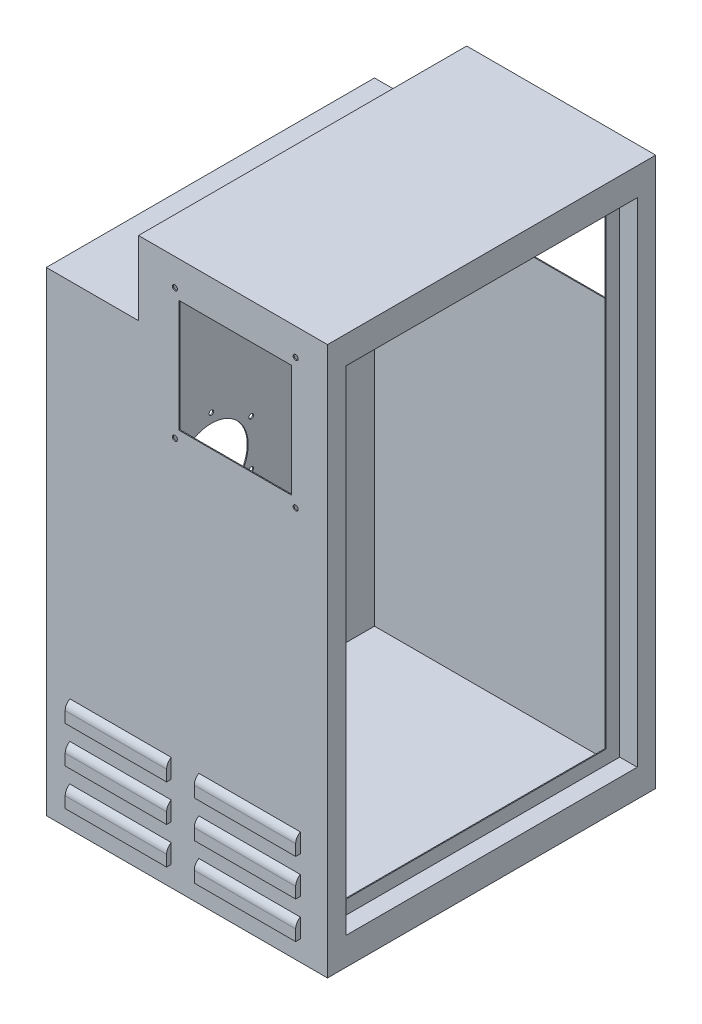
from build123d import *

# Parameters (mm, degrees)
EXTRUDE_1_DEPTH                = 1
SKETCH_2_R                     = 2.75
SKETCH_2_W                     = 122
SKETCH_2_H                     = 122
CUT_EXTRUDE_2_DEPTH            = 5.5
SKETCH_7_W                     = 110
SKETCH_7_H                     = 20.62
EXTRUDE_4_DEPTH                = 5
FILLET_2_R                     = 10
PATTERN_LINEAR_3_COUNT         = 2
PATTERN_LINEAR_3_PITCH         = 140
FILLET_2_OF_PATTERN_LINEAR_3_R = 10
PATTERN_START                  = 25.494191811
PATTERN_LINEAR_4_DEPTH         = 110
PATTERN_START_2                = 165.494191811
PATTERN_LINEAR_4_2_DEPTH       = 110
EXTRUDE_4_2_DEPTH              = 355
SKETCH_19_R                    = 40
SKETCH_19_R_2                  = 2.5
CUT_EXTRUDE_3_DEPTH            = 355
PATTERN_CIRCULAR_1_COUNT       = 6
SKETCH_20_R                    = 30
CUT_EXTRUDE_4_DEPTH            = 355
PATTERN_CIRCULAR_2_COUNT       = 7
WRAP_3_DEPTH                   = 1
SKETCH_57_R                    = 1.6
SKETCH_57_R_2                  = 10.25
SKETCH_57_R_3                  = 1.75
SKETCH_57_R_4                  = 16.25
SKETCH_57_R_5                  = 2.25
SKETCH_57_R_6                  = 27.75
CUT_EXTRUDE_5_DEPTH            = 355
SKETCH_58_W                    = 356
SKETCH_58_H                    = 595
SKETCH_58_W_2                  = 316
SKETCH_58_H_2                  = 535
EXTRUDE_5_DEPTH                = 19
SKETCH_60_W                    = 318
SKETCH_60_H                    = 537
SKETCH_60_W_2                  = 316
SKETCH_60_H_2                  = 535
EXTRUDE_6_DEPTH                = 19
SKETCH_62_W                    = 318
SKETCH_62_H                    = 537
SKETCH_62_W_2                  = 286
SKETCH_62_H_2                  = 505
EXTRUDE_7_DEPTH                = 1


# Read off the part's stored shape, not the designer's step: 阵列(线性)4, 包覆3
with BuildPart() as part:
    # Sketch 1 → 凸台-拉伸1 (new body)
    with BuildSketch(Plane.XY):
        Polygon((0, 0), (0, 515), (100, 515), (100, 595), (305, 595), (305, 0), align=None)
    extrude(amount=-EXTRUDE_1_DEPTH)

    # Sketch 2 → 切除-拉伸2 (cut)
    with BuildSketch(Plane.XY):
        with Locations((139.5, 565.657827013)):
            Circle(SKETCH_2_R)
        with Locations((270.5, 565.657827013)):
            Circle(SKETCH_2_R)
        with Locations(Location((270.5, 424.342172987, 0), (0, 0, 180))):
            Circle(SKETCH_2_R)
        with Locations(Location((139.5, 424.342172987, 0), (0, 0, 180))):
            Circle(SKETCH_2_R)
        with Locations((205, 495)):
            Rectangle(SKETCH_2_W, SKETCH_2_H)
    extrude(amount=-CUT_EXTRUDE_2_DEPTH, mode=Mode.SUBTRACT)

    # 草图7 → Extrude 4 (add)
    with BuildSketch(Plane(origin=(0, 0, -1), x_dir=(-1, 0, 0), z_dir=(0, 0, -1))):
        with Locations((-220.494191811, 112.213490862)):
            Rectangle(SKETCH_7_W, SKETCH_7_H)
    extrude_4 = extrude(amount=EXTRUDE_4_DEPTH)

    # 圆角2
    # the kernel refuses this fillet: 10 mm, written as the material it takes off along each edge
    with BuildSketch(Plane(origin=(297.144826906, 122.523490862, -6), x_dir=(0, 0, 1), z_dir=(-1, 0, 0))) as fillet_2_piece_1:
        with BuildLine():
            CenterArc((10, -8.660254038), FILLET_2_R, 120, 60)
            Line((0, -8.660254038), (-0.2, -8.660254038))
            Line((-0.2, -8.660254038), (-0.2, 0))
            Line((-0.2, 0), (0, 0.2))
            ThreePointArc((0, 0.2), (2.5, 0.2), (4.9, 0.173205081))
            Line((4.9, 0.173205081), (5, 0))
        make_face()
    extrude(amount=153.301270189, mode=Mode.SUBTRACT)

    # 阵列(线性)3: Extrude 4 ×2
    with Locations(*[(-i * PATTERN_LINEAR_3_PITCH, 0, 0) for i in range(1, PATTERN_LINEAR_3_COUNT)]):
        add(extrude_4)

    # 圆角2 of 阵列(线性)3
    # the kernel refuses this fillet: 10 mm, written as the material it takes off along each edge
    with BuildSketch(Plane(origin=(157.144826906, 122.523490862, -6), x_dir=(0, 0, 1), z_dir=(-1, 0, 0))) as fillet_2_of_pattern_linear_3_piece_1:
        with BuildLine():
            CenterArc((10, -8.660254038), FILLET_2_OF_PATTERN_LINEAR_3_R, 120, 60)
            Line((0, -8.660254038), (-0.2, -8.660254038))
            Line((-0.2, -8.660254038), (-0.2, 0))
            Line((-0.2, 0), (0, 0.2))
            ThreePointArc((0, 0.2), (2.5, 0.2), (4.9, 0.173205081))
            Line((4.9, 0.173205081), (5, 0))
        make_face()
    extrude(amount=153.301270189, mode=Mode.SUBTRACT)

    # 阵列(线性)4 outline → 阵列(线性)4 (add)
    with BuildSketch(Plane.YZ.offset(PATTERN_START)):
        with BuildLine():
            Line((21.903490862, -6), (33.863236824, -6))
            ThreePointArc((33.863236824, -6), (38.863236824, -4.660254038), (42.523490862, -1))
            Line((42.523490862, -1), (21.903490862, -1))
            Line((21.903490862, -1), (21.903490862, -6))
        make_face()
        with BuildLine():
            Line((82.523490862, -1), (61.903490862, -1))
            Line((61.903490862, -1), (61.903490862, -6))
            Line((61.903490862, -6), (73.863236824, -6))
            ThreePointArc((73.863236824, -6), (78.863236824, -4.660254038), (82.523490862, -1))
        make_face()
    extrude(amount=PATTERN_LINEAR_4_DEPTH)

    # Pattern Linear 4 2 outline → Pattern Linear 4 2 (add)
    with BuildSketch(Plane.YZ.offset(PATTERN_START_2)):
        with BuildLine():
            Line((21.903490862, -6), (33.863236824, -6))
            ThreePointArc((33.863236824, -6), (38.863236824, -4.660254038), (42.523490862, -1))
            Line((42.523490862, -1), (21.903490862, -1))
            Line((21.903490862, -1), (21.903490862, -6))
        make_face()
        with BuildLine():
            Line((82.523490862, -1), (61.903490862, -1))
            Line((61.903490862, -1), (61.903490862, -6))
            Line((61.903490862, -6), (73.863236824, -6))
            ThreePointArc((73.863236824, -6), (78.863236824, -4.660254038), (82.523490862, -1))
        make_face()
    extrude(amount=PATTERN_LINEAR_4_2_DEPTH)

    # 草图13 → Extrude 4 2 (add)
    with BuildSketch(Plane.XY):
        Polygon((305, 595), (100, 595), (100, 515), (0, 515), (0, 0), (305, 0), (305, 1), (1, 1), (1, 514), (101, 514), (101, 594), (305, 594), align=None)
    extrude(amount=EXTRUDE_4_2_DEPTH)

    # 镜向2: part across plane


with BuildPart() as part_1:
    add(part.part)
    add(part.part.mirror(Plane(origin=(0, 0, 177), x_dir=(1, 0, 0), z_dir=(0, 0, -1))))

    # 草图19 → 切除-拉伸3 (cut)
    with BuildSketch(Plane.ZY):
        with Locations((177, 240)):
            Circle(SKETCH_19_R)
        with Locations((177, 290)):
            Circle(SKETCH_19_R_2)
    cut_extrude_3 = extrude(amount=-CUT_EXTRUDE_3_DEPTH, mode=Mode.SUBTRACT)

    # 阵列(圆周)1: 切除-拉伸3 ×6 about axis
    pattern_circular_1_axis = Axis((0, 240, 177), (1, 0, 0))
    for i in range(1, PATTERN_CIRCULAR_1_COUNT):
        add(cut_extrude_3.rotate(pattern_circular_1_axis, i * 360 / PATTERN_CIRCULAR_1_COUNT), mode=Mode.SUBTRACT)

    # 草图20 → 切除-拉伸4 (cut)
    with BuildSketch(Plane.ZY):
        with Locations((177, 57.5)):
            Circle(SKETCH_20_R)
        with BuildLine():
            Line((181, 102.5), (181, 97.5))
            ThreePointArc((181, 97.5), (177, 93.5), (173, 97.5))
            Line((173, 97.5), (173, 102.5))
            ThreePointArc((173, 102.5), (177, 106.5), (181, 102.5))
        make_face()
    cut_extrude_4 = extrude(amount=-CUT_EXTRUDE_4_DEPTH, mode=Mode.SUBTRACT)

    # 阵列(圆周)2: 切除-拉伸4 ×7 about axis
    pattern_circular_2_axis = Axis((0, 57.5, 177), (1, 0, 0))
    for i in range(1, PATTERN_CIRCULAR_2_COUNT):
        add(cut_extrude_4.rotate(pattern_circular_2_axis, i * 360 / PATTERN_CIRCULAR_2_COUNT), mode=Mode.SUBTRACT)

    # 包覆3 outline → 包覆3 (add)
    with BuildSketch(Plane.ZY):
        Polygon((7.082692308, 2.849358974), (7.082692308, 0), (7.367628205, 0), (7.367628205, 2.849358974), (8.059615385, 2.849358974), (8.059615385, 3.175), (6.390705128, 3.175), (6.390705128, 2.849358974), align=None)
        Polygon((0.732692308, 0), (1.017628205, 0), (1.017628205, 2.849358974), (1.709615385, 2.849358974), (1.709615385, 3.175), (0.040705128, 3.175), (0.040705128, 2.849358974), (0.732692308, 2.849358974), align=None)
        Polygon((2.198076923, 0), (3.989102564, 0), (3.989102564, 0.325641026), (2.483012821, 0.325641026), (2.483012821, 1.546794872), (3.989102564, 1.546794872), (3.989102564, 1.872435897), (2.483012821, 1.872435897), (2.483012821, 2.849358974), (3.989102564, 2.849358974), (3.989102564, 3.175), (2.198076923, 3.175), align=None)
        with BuildLine():
            add(Edge.make_bspline(
                [(4.931044671, 2.11857472), (4.937994631, 2.11237256), (4.954506143, 2.09763765), (4.984692161, 2.073514653), (5.024554557, 2.043757852), (5.073052411, 2.006939358), (5.131079946, 1.964229746), (5.198643544, 1.916175112), (5.274990077, 1.861215445), (5.329166386, 1.822791105), (5.3578125, 1.802473958)],
                knots=[0, 0, 0, 0, 0.052594282, 0.124951974, 0.218093899, 0.333502411, 0.468789179, 0.624937586, 0.801683048, 1, 1, 1, 1], degree=3))
            add(Edge.make_bspline(
                [(4.721794872, 2.52880609), (4.722151494, 2.51179582), (4.722865321, 2.477747465), (4.73282103, 2.427445104), (4.745611136, 2.377269817), (4.765879095, 2.327447189), (4.793860192, 2.277105877), (4.830604173, 2.225379015), (4.876880534, 2.17181068), (4.912328967, 2.136969705), (4.931044671, 2.11857472)],
                knots=[0, 0, 0, 0, 0.107285214, 0.214745861, 0.32293856, 0.434116163, 0.553412311, 0.686072985, 0.834255992, 1, 1, 1, 1], degree=3))
            add(Edge.make_bspline(
                [(5.187359776, 2.930769231), (5.154560645, 2.929670046), (5.09131061, 2.927550371), (5.001512325, 2.904400099), (4.920691407, 2.867949411), (4.851247294, 2.816863681), (4.793428751, 2.756338209), (4.751604513, 2.686688819), (4.72643115, 2.609779068), (4.72335931, 2.556129137), (4.721794872, 2.52880609)],
                knots=[0, 0, 0, 0, 0.143073084, 0.275902964, 0.402370856, 0.528413645, 0.650356379, 0.765895086, 0.880774131, 1, 1, 1, 1], degree=3))
            add(Edge.make_bspline(
                [(5.807476963, 2.523717949), (5.791923153, 2.543755546), (5.761970151, 2.582343275), (5.716495545, 2.636382968), (5.673634272, 2.685746489), (5.631406409, 2.728622712), (5.592042186, 2.767359647), (5.553836012, 2.80052457), (5.517337708, 2.828442431), (5.471330225, 2.858236232), (5.413529152, 2.887769632), (5.340971751, 2.912760581), (5.265147059, 2.927778387), (5.21350375, 2.929764021), (5.187359776, 2.930769231)],
                knots=[0, 0, 0, 0, 0.098469431, 0.189629101, 0.274184089, 0.352183161, 0.423198873, 0.488550946, 0.548473346, 0.601440164, 0.701198082, 0.799591802, 0.898545098, 1, 1, 1, 1], degree=3))
            Line((5.807476963, 2.523717949), (6.065064103, 2.718975361))
            add(Edge.make_bspline(
                [(5.219160657, 3.256410256), (5.256574948, 3.255119799), (5.330980031, 3.252553491), (5.440426106, 3.230240016), (5.54580047, 3.193318692), (5.63056686, 3.151418981), (5.696908722, 3.109571197), (5.747502558, 3.071453213), (5.79877196, 3.027570079), (5.851130481, 2.977804906), (5.903690936, 2.921701067), (5.95723364, 2.8596428), (6.011883798, 2.792009352), (6.047040899, 2.743727127), (6.065064103, 2.718975361)],
                knots=[0, 0, 0, 0, 0.107232799, 0.213251813, 0.318830447, 0.426793531, 0.483645951, 0.543603822, 0.60830765, 0.67712676, 0.750685636, 0.828713418, 0.912190348, 1, 1, 1, 1], degree=3))
            add(Edge.make_bspline(
                [(4.436858974, 2.51544972), (4.438042985, 2.549041015), (4.4403857, 2.615505616), (4.460198169, 2.712597869), (4.491470008, 2.805295548), (4.535280371, 2.892680922), (4.591756684, 2.972478633), (4.657112675, 3.045606582), (4.734955952, 3.107082367), (4.820365832, 3.160796163), (4.913852683, 3.202838538), (5.01181586, 3.234553141), (5.114411061, 3.252522968), (5.183901047, 3.255101762), (5.219160657, 3.256410256)],
                knots=[0, 0, 0, 0, 0.083785371, 0.165779888, 0.246280008, 0.327460928, 0.408796954, 0.489715241, 0.571376032, 0.655523321, 0.741019483, 0.826546761, 0.911988852, 1, 1, 1, 1], degree=3))
            add(Edge.make_bspline(
                [(4.614307893, 2.032076322), (4.600272084, 2.050764406), (4.572668782, 2.08751703), (4.536232477, 2.144961722), (4.505263379, 2.203765684), (4.480986121, 2.264086933), (4.460542551, 2.325078618), (4.446792142, 2.387536534), (4.438182089, 2.451180424), (4.437300359, 2.494009814), (4.436858974, 2.51544972)],
                knots=[0, 0, 0, 0, 0.133506769, 0.262558979, 0.388264447, 0.512667355, 0.63372227, 0.75539386, 0.877552945, 1, 1, 1, 1], degree=3))
            add(Edge.make_bspline(
                [(5.134570313, 1.600220353), (5.101165687, 1.624013428), (5.037298588, 1.669503978), (4.947982588, 1.737017435), (4.868113682, 1.798742946), (4.79804686, 1.855261585), (4.73781294, 1.90658102), (4.686937275, 1.952208436), (4.646715869, 1.993377809), (4.624349735, 2.020085312), (4.614307893, 2.032076322)],
                knots=[0, 0, 0, 0, 0.181535301, 0.347081672, 0.495567816, 0.628357302, 0.74551967, 0.845830751, 0.930781807, 1, 1, 1, 1], degree=3))
            add(Edge.make_bspline(
                [(5.706986178, 1.093950321), (5.692770692, 1.112135653), (5.662927058, 1.150313485), (5.611621314, 1.207141663), (5.551417768, 1.2657598), (5.484376686, 1.32840623), (5.408055955, 1.392167303), (5.324845996, 1.460083527), (5.232622352, 1.5295721), (5.167943523, 1.576174356), (5.134570313, 1.600220353)],
                knots=[0, 0, 0, 0, 0.090279215, 0.189529918, 0.299197872, 0.418925887, 0.548376285, 0.68813637, 0.839083502, 1, 1, 1, 1], degree=3))
            add(Edge.make_bspline(
                [(5.820833333, 0.782301683), (5.819495923, 0.808736596), (5.816777163, 0.862474913), (5.793797892, 0.941758884), (5.757648932, 1.020220001), (5.724299962, 1.068753292), (5.706986178, 1.093950321)],
                knots=[0, 0, 0, 0, 0.234723374, 0.477158319, 0.728556284, 1, 1, 1, 1], degree=3))
            add(Edge.make_bspline(
                [(5.198808093, 0.244230769), (5.226645459, 0.245006079), (5.281833103, 0.246543133), (5.363078852, 0.261312147), (5.441983773, 0.284001721), (5.516921609, 0.316496423), (5.586858345, 0.355810621), (5.648187275, 0.403296082), (5.70120625, 0.456460283), (5.744575946, 0.515771691), (5.777849978, 0.57955939), (5.803424212, 0.645033288), (5.817616529, 0.713221918), (5.819754441, 0.759132838), (5.820833333, 0.782301683)],
                knots=[0, 0, 0, 0, 0.091263605, 0.180930311, 0.27008822, 0.360156133, 0.448342532, 0.532665842, 0.613833704, 0.693981527, 0.772715977, 0.849335172, 0.923967327, 1, 1, 1, 1], degree=3))
            add(Edge.make_bspline(
                [(4.501732772, 0.773397436), (4.526695745, 0.731610458), (4.574523837, 0.651548221), (4.654308284, 0.543364142), (4.736978853, 0.451414185), (4.823147749, 0.376233263), (4.912289002, 0.317043201), (5.004984536, 0.275131177), (5.100921979, 0.24899097), (5.166212517, 0.245815892), (5.198808093, 0.244230769)],
                knots=[0, 0, 0, 0, 0.159004299, 0.3046461, 0.438546905, 0.562322299, 0.677432543, 0.786897393, 0.893610889, 1, 1, 1, 1], degree=3))
            Line((4.501732772, 0.773397436), (4.233333333, 0.612484976))
            add(Edge.make_bspline(
                [(4.810203862, 6e-09), (4.80423564, 0.002688656), (4.777216664, 0.015230497), (4.729894923, 0.040257623), (4.66928183, 0.07771811), (4.610159543, 0.12131335), (4.553082597, 0.172089307), (4.496178264, 0.228645587), (4.441126126, 0.292518026), (4.386812631, 0.362674716), (4.334308645, 0.439772046), (4.282527373, 0.523390074), (4.250037627, 0.582231974), (4.233333333, 0.612484976)],
                knots=[0.318177202, 0.318177202, 0.318177202, 0.318177202, 0.333794217, 0.389241459, 0.445822073, 0.503704281, 0.564293892, 0.627975416, 0.69503826, 0.765372726, 0.839611443, 0.91753775, 1, 1, 1, 1], degree=3))
            Line((4.810203862, 6e-09), (5.588919181, -3e-09))
            add(Edge.make_bspline(
                [(6.105769231, 0.777849559), (6.105173113, 0.7493849), (6.103992453, 0.693008344), (6.090420766, 0.610226953), (6.070536499, 0.529826093), (6.040567008, 0.452799584), (6.003988143, 0.377738263), (5.957573047, 0.306611097), (5.903772504, 0.237843864), (5.84205616, 0.173270268), (5.774523092, 0.113991933), (5.70314574, 0.06126057), (5.640440015, 0.02466537), (5.601710054, 0.005836497), (5.588919181, -3e-09)],
                knots=[0, 0, 0, 0, 0.061484255, 0.121774528, 0.18091956, 0.240256115, 0.300114444, 0.361145948, 0.423500582, 0.488669361, 0.553954105, 0.617581261, 0.680238427, 0.710624473, 0.710624473, 0.710624473, 0.710624473], degree=3))
            add(Edge.make_bspline(
                [(5.3578125, 1.802473958), (5.39227115, 1.777399296), (5.45899555, 1.728845689), (5.553934926, 1.655897179), (5.640017166, 1.584552418), (5.717544501, 1.515267017), (5.787282839, 1.448566533), (5.848458486, 1.383648505), (5.901694781, 1.320978021), (5.959007358, 1.240630042), (6.017570523, 1.141950058), (6.06786389, 1.021047656), (6.099576106, 0.899675279), (6.103723123, 0.818098792), (6.105769231, 0.777849559)],
                knots=[0, 0, 0, 0, 0.09697231, 0.187773439, 0.272396139, 0.351320997, 0.424334774, 0.491908784, 0.55423322, 0.611267658, 0.716347845, 0.814540086, 0.908495456, 1, 1, 1, 1], degree=3))
        make_face()
        with BuildLine():
            add(Edge.make_bspline(
                [(182.432692308, 438.743589744), (182.747186448, 438.21713963), (183.349745083, 437.208481528), (184.354903474, 435.845532495), (185.396422459, 434.687107846), (186.482014842, 433.739946617), (187.605054249, 432.994245054), (188.772872006, 432.466219549), (189.9815327, 432.136894116), (190.80409066, 432.096893127), (191.21474359, 432.076923077)],
                knots=[0, 0, 0, 0, 0.159004299, 0.3046461, 0.438546905, 0.562322299, 0.677432543, 0.786897393, 0.893610889, 1, 1, 1, 1], degree=3))
            Line((182.432692308, 438.743589744), (179.051282051, 436.716346154))
            add(Edge.make_bspline(
                [(191.21474359, 427.974358974), (190.912625384, 427.98020105), (190.312193841, 427.991811626), (189.424085477, 428.09445483), (188.553918743, 428.239678872), (187.712612662, 428.470239671), (186.889327958, 428.749976552), (186.087645278, 429.094414639), (185.307176091, 429.507182655), (184.543546572, 429.979125794), (183.798698863, 430.52835716), (183.079619229, 431.168054262), (182.362714252, 431.880574319), (181.669144008, 432.685266472), (180.984879502, 433.569130276), (180.323411964, 434.540435229), (179.671049477, 435.593890701), (179.261729844, 436.335205966), (179.051282051, 436.716346154)],
                knots=[0, 0, 0, 0, 0.057208269, 0.11369606, 0.169177916, 0.224159217, 0.278719878, 0.333794217, 0.389241459, 0.445822073, 0.503704281, 0.564293892, 0.627975416, 0.69503826, 0.765372726, 0.839611443, 0.91753775, 1, 1, 1, 1], degree=3))
            add(Edge.make_bspline(
                [(202.641025641, 438.799679487), (202.633515491, 438.4410696), (202.618641033, 437.730813788), (202.447659161, 436.687898624), (202.197148702, 435.674974399), (201.819580314, 434.704561685), (201.35874422, 433.758907255), (200.773987101, 432.862816964), (200.09618499, 431.996458123), (199.318656248, 431.182932508), (198.467845936, 430.43611884), (197.568603712, 429.771786708), (196.619457735, 429.217863012), (195.625556973, 428.765853389), (194.586673125, 428.412327474), (193.503155595, 428.156180399), (192.373218324, 427.998972274), (191.605212821, 427.982655), (191.21474359, 427.974358974)],
                knots=[0, 0, 0, 0, 0.061484255, 0.121774528, 0.18091956, 0.240256115, 0.300114444, 0.361145948, 0.423500582, 0.488669361, 0.553954105, 0.617581261, 0.680238427, 0.742187389, 0.804663212, 0.868258989, 0.933020257, 1, 1, 1, 1], degree=3))
            add(Edge.make_bspline(
                [(193.217948718, 451.708333333), (193.652073441, 451.392432081), (194.4926958, 450.78073309), (195.688782428, 449.861696747), (196.773283092, 448.962865106), (197.750005418, 448.089978168), (198.628598657, 447.249657105), (199.399315465, 446.431792187), (200.070008955, 445.642242785), (200.792057166, 444.629984777), (201.529860817, 443.386772385), (202.163478045, 441.863592516), (202.563002016, 440.33449171), (202.615247907, 439.306756436), (202.641025641, 438.799679487)],
                knots=[0, 0, 0, 0, 0.09697231, 0.187773439, 0.272396139, 0.351320997, 0.424334774, 0.491908784, 0.55423322, 0.611267658, 0.716347845, 0.814540086, 0.908495456, 1, 1, 1, 1], degree=3))
            add(Edge.make_bspline(
                [(187.841346154, 455.690705128), (187.928904696, 455.61256769), (188.136923749, 455.426931024), (188.517220043, 455.123019245), (189.019423451, 454.748130419), (189.630420036, 454.284275373), (190.361475599, 453.74620152), (191.212670526, 453.14078881), (192.174516616, 452.448383564), (192.857052797, 451.964297386), (193.217948718, 451.708333333)],
                knots=[0, 0, 0, 0, 0.052594282, 0.124951974, 0.218093899, 0.333502411, 0.468789179, 0.624937586, 0.801683048, 1, 1, 1, 1], degree=3))
            add(Edge.make_bspline(
                [(185.205128205, 460.858974359), (185.209621081, 460.644671747), (185.218614179, 460.215716096), (185.344040439, 459.58198556), (185.505175627, 458.949855966), (185.76051999, 458.322169305), (186.113037745, 457.687948059), (186.575954041, 457.036271058), (187.158963322, 456.361394388), (187.605557749, 455.922452973), (187.841346154, 455.690705128)],
                knots=[0, 0, 0, 0, 0.107285214, 0.214745861, 0.32293856, 0.434116163, 0.553412311, 0.686072985, 0.834255992, 1, 1, 1, 1], degree=3))
            add(Edge.make_bspline(
                [(191.070512821, 465.923076923), (190.657295422, 465.909228924), (189.860444594, 465.882524361), (188.72912761, 465.590867386), (187.710911323, 465.131646126), (186.836024866, 464.488046376), (186.107602271, 463.725520745), (185.580682742, 462.848048116), (185.263538004, 461.879106372), (185.224837666, 461.203201728), (185.205128205, 460.858974359)],
                knots=[0, 0, 0, 0, 0.143073084, 0.275902964, 0.402370856, 0.528413645, 0.650356379, 0.765895086, 0.880774131, 1, 1, 1, 1], degree=3))
            add(Edge.make_bspline(
                [(198.883012821, 460.794871795), (198.687059307, 461.047313971), (198.309698654, 461.533458579), (197.736790233, 462.214273615), (197.196805685, 462.836176238), (196.664801116, 463.37634913), (196.1688739, 463.864373511), (195.687536274, 464.282199303), (195.227715117, 464.633920394), (194.648093281, 465.009275365), (193.919890786, 465.381349691), (193.0057818, 465.696196298), (192.050510086, 465.885397005), (191.399885726, 465.910412863), (191.070512821, 465.923076923)],
                knots=[0, 0, 0, 0, 0.098469431, 0.189629101, 0.274184089, 0.352183161, 0.423198873, 0.488550946, 0.548473346, 0.601440164, 0.701198082, 0.799591802, 0.898545098, 1, 1, 1, 1], degree=3))
            Line((198.883012821, 460.794871795), (202.128205128, 463.254807692))
            add(Edge.make_bspline(
                [(191.471153846, 470.025641026), (191.942514992, 470.009383293), (192.87990187, 469.977051852), (194.258750047, 469.695937208), (195.586301092, 469.230786674), (196.654224119, 468.702916297), (197.490027107, 468.175700117), (198.127429766, 467.695473554), (198.773343489, 467.14261517), (199.432978402, 466.515652358), (200.095157367, 465.808832345), (200.769711107, 465.0269959), (201.458217036, 464.174920976), (201.901141152, 463.566640968), (202.128205128, 463.254807692)],
                knots=[0, 0, 0, 0, 0.107232799, 0.213251813, 0.318830447, 0.426793531, 0.483645951, 0.543603822, 0.60830765, 0.67712676, 0.750685636, 0.828713418, 0.912190348, 1, 1, 1, 1], degree=3))
            add(Edge.make_bspline(
                [(181.615384615, 460.690705128), (181.63030129, 461.113902552), (181.659815805, 461.951251852), (181.909421716, 463.174461342), (182.303397644, 464.342306111), (182.855339219, 465.44322421), (183.566851824, 466.448549706), (184.390234388, 467.3698467), (185.370937088, 468.144344783), (186.446967068, 468.821054022), (187.624754178, 469.350721738), (188.858935931, 469.750275797), (190.151473897, 469.976667314), (191.026938293, 470.009156055), (191.471153846, 470.025641026)],
                knots=[0, 0, 0, 0, 0.083785371, 0.165779888, 0.246280008, 0.327460928, 0.408796954, 0.489715241, 0.571376032, 0.655523321, 0.741019483, 0.826546761, 0.911988852, 1, 1, 1, 1], degree=3))
            add(Edge.make_bspline(
                [(183.850961538, 454.600961538), (183.67413245, 454.83640196), (183.326374316, 455.299427146), (182.867334254, 456.023139806), (182.477172393, 456.763977125), (182.171317169, 457.523929863), (181.913760382, 458.29232905), (181.740526888, 459.079200429), (181.632053781, 459.881013212), (181.620945363, 460.420596076), (181.615384615, 460.690705128)],
                knots=[0, 0, 0, 0, 0.133506769, 0.262558979, 0.388264447, 0.512667355, 0.63372227, 0.75539386, 0.877552945, 1, 1, 1, 1], degree=3))
            add(Edge.make_bspline(
                [(190.405448718, 449.16025641), (189.984603047, 449.460011697), (189.179978172, 450.03312098), (188.054737231, 450.883684226), (187.048514797, 451.661328449), (186.165783179, 452.373374302), (185.406930644, 453.019918356), (184.765977375, 453.594751946), (184.259251008, 454.113421213), (183.977472944, 454.44989369), (183.850961538, 454.600961538)],
                knots=[0, 0, 0, 0, 0.181535301, 0.347081672, 0.495567816, 0.628357302, 0.74551967, 0.845830751, 0.930781807, 1, 1, 1, 1], degree=3))
            add(Edge.make_bspline(
                [(197.616987179, 442.782051282), (197.437894446, 443.011157838), (197.061911654, 443.492138393), (196.415540082, 444.208083941), (195.657070204, 444.946580157), (194.812458148, 445.735826523), (193.850937132, 446.539115628), (192.802622682, 447.39475309), (191.640750008, 448.270199685), (190.825898618, 448.857314719), (190.405448718, 449.16025641)],
                knots=[0, 0, 0, 0, 0.090279215, 0.189529918, 0.299197872, 0.418925887, 0.548376285, 0.68813637, 0.839083502, 1, 1, 1, 1], degree=3))
            add(Edge.make_bspline(
                [(199.051282051, 438.855769231), (199.034432786, 439.188807513), (199.000180692, 439.865825675), (198.710678063, 440.864678851), (198.255258099, 441.853165366), (197.835113599, 442.464608401), (197.616987179, 442.782051282)],
                knots=[0, 0, 0, 0, 0.234723374, 0.477158319, 0.728556284, 1, 1, 1, 1], degree=3))
            add(Edge.make_bspline(
                [(191.21474359, 432.076923077), (191.565450567, 432.086690763), (192.260727973, 432.106055223), (193.284296464, 432.292121532), (194.278374204, 432.577974434), (195.222472921, 432.987356508), (196.103565659, 433.482653488), (196.876213606, 434.080895517), (197.544169185, 434.750680725), (198.090559066, 435.497911064), (198.509759469, 436.301535619), (198.831954536, 437.126403634), (199.010755378, 437.985472986), (199.037689703, 438.563878276), (199.051282051, 438.855769231)],
                knots=[0, 0, 0, 0, 0.091263605, 0.180930311, 0.27008822, 0.360156133, 0.448342532, 0.532665842, 0.613833704, 0.693981527, 0.772715977, 0.849335172, 0.923967327, 1, 1, 1, 1], degree=3))
        make_face()
        Polygon((147.256410256, 464.897435897), (147.256410256, 469), (126.230769231, 469), (126.230769231, 464.897435897), (134.948717949, 464.897435897), (134.948717949, 429), (138.538461538, 429), (138.538461538, 464.897435897), align=None)
        Polygon((175.974358974, 464.897435897), (175.974358974, 469), (153.41025641, 469), (153.41025641, 429), (175.974358974, 429), (175.974358974, 433.102564103), (157, 433.102564103), (157, 448.487179487), (175.974358974, 448.487179487), (175.974358974, 452.58974359), (157, 452.58974359), (157, 464.897435897), align=None)
        Polygon((227.256410256, 464.897435897), (227.256410256, 469), (206.230769231, 469), (206.230769231, 464.897435897), (214.948717949, 464.897435897), (214.948717949, 429), (218.538461538, 429), (218.538461538, 464.897435897), align=None)
    extrude(amount=WRAP_3_DEPTH)

    # 草图57 → 切除-拉伸5 (cut)
    with BuildSketch(Plane.ZY.offset(-100)):
        with Locations((315.22107116, 587.726318862)):
            Circle(SKETCH_57_R)
        with Locations((340.22107116, 587.726318862)):
            Circle(SKETCH_57_R)
        with Locations((338.72107116, 538.726318862)):
            Circle(SKETCH_57_R)
        with Locations((338.72107116, 560.726318862)):
            Circle(SKETCH_57_R)
        with Locations((316.72107116, 560.726318862)):
            Circle(SKETCH_57_R)
        with Locations((316.72107116, 538.726318862)):
            Circle(SKETCH_57_R)
        with Locations((327.72107116, 549.726318862)):
            Circle(SKETCH_57_R_2)
        with Locations((293.72107116, 538.726318862)):
            Circle(SKETCH_57_R)
        with Locations((226.72107116, 538.726318862)):
            Circle(SKETCH_57_R)
        with Locations((248.72107116, 538.726318862)):
            Circle(SKETCH_57_R)
        with Locations((271.72107116, 538.726318862)):
            Circle(SKETCH_57_R)
        with Locations((282.72107116, 549.726318862)):
            Circle(SKETCH_57_R_2)
        with Locations((293.72107116, 560.726318862)):
            Circle(SKETCH_57_R)
        with Locations((271.72107116, 560.726318862)):
            Circle(SKETCH_57_R)
        with Locations((295.22107116, 587.726318862)):
            Circle(SKETCH_57_R)
        with Locations((270.22107116, 587.726318862)):
            Circle(SKETCH_57_R)
        with Locations((250.22107116, 587.726318862)):
            Circle(SKETCH_57_R)
        with Locations((225.22107116, 587.726318862)):
            Circle(SKETCH_57_R)
        with Locations((248.72107116, 560.726318862)):
            Circle(SKETCH_57_R)
        with Locations((237.72107116, 549.726318862)):
            Circle(SKETCH_57_R_2)
        with Locations((226.72107116, 560.726318862)):
            Circle(SKETCH_57_R)
        with Locations((195.924122843, 533.726318862)):
            Circle(SKETCH_57_R_3)
        with Locations((163.924122843, 533.726318862)):
            Circle(SKETCH_57_R_3)
        with Locations((195.924122843, 565.726318862)):
            Circle(SKETCH_57_R_3)
        with Locations((163.924122843, 565.726318862)):
            Circle(SKETCH_57_R_3)
        with Locations((192.424122843, 587.726318862)):
            Circle(SKETCH_57_R)
        with Locations((167.424122843, 587.726318862)):
            Circle(SKETCH_57_R)
        with Locations((179.924122843, 549.726318862)):
            Circle(SKETCH_57_R_4)
        with Locations((113.72107116, 538.726318862)):
            Circle(SKETCH_57_R)
        with Locations((91.72107116, 538.726318862)):
            Circle(SKETCH_57_R)
        with Locations((91.72107116, 560.726318862)):
            Circle(SKETCH_57_R)
        with Locations((113.72107116, 560.726318862)):
            Circle(SKETCH_57_R)
        with Locations((102.72107116, 549.726318862)):
            Circle(SKETCH_57_R_2)
        with Locations((115.22107116, 587.726318862)):
            Circle(SKETCH_57_R)
        with Locations((90.22107116, 587.726318862)):
            Circle(SKETCH_57_R)
        with Locations((68.72107116, 575.726318862)):
            Circle(SKETCH_57_R_5)
        with Locations((55.22107116, 587.726318862)):
            Circle(SKETCH_57_R)
        with Locations((30.22107116, 587.726318862)):
            Circle(SKETCH_57_R)
        with Locations((68.72107116, 523.726318862)):
            Circle(SKETCH_57_R_5)
        with Locations((16.72107116, 523.726318862)):
            Circle(SKETCH_57_R_5)
        with Locations((16.72107116, 575.726318862)):
            Circle(SKETCH_57_R_5)
        with Locations((42.72107116, 549.726318862)):
            Circle(SKETCH_57_R_6)
    extrude(amount=-CUT_EXTRUDE_5_DEPTH, mode=Mode.SUBTRACT)

    # 草图58 → 凸台-拉伸5 (add)
    with BuildSketch(Plane(origin=(305, 0, 0), x_dir=(0, 0, -1), z_dir=(1, 0, 0))):
        with Locations((-177, 297.5)):
            Rectangle(SKETCH_58_W, SKETCH_58_H)
        with Locations((-177, 297.5)):
            Rectangle(SKETCH_58_W_2, SKETCH_58_H_2, mode=Mode.SUBTRACT)
    extrude(amount=-EXTRUDE_5_DEPTH)



with BuildPart() as body_2:
    # 草图60 → 凸台-拉伸6 (new body)
    with BuildSketch(Plane(origin=(305, 0, 0), x_dir=(0, 0, -1), z_dir=(1, 0, 0))):
        with Locations((-177, 297.5)):
            Rectangle(SKETCH_60_W, SKETCH_60_H)
        with Locations((-177, 297.5)):
            Rectangle(SKETCH_60_W_2, SKETCH_60_H_2, mode=Mode.SUBTRACT)
    extrude(amount=-EXTRUDE_6_DEPTH)


with BuildPart() as part_2:
    add(part_1.part)

    add(body_2.part)  # 凸台-拉伸7 merges body 2
    # 草图62 → 凸台-拉伸7 (add)
    with BuildSketch(Plane.ZY.offset(-286)):
        with Locations((177, 297.5)):
            Rectangle(SKETCH_62_W, SKETCH_62_H)
        with Locations((177, 297.5)):
            Rectangle(SKETCH_62_W_2, SKETCH_62_H_2, mode=Mode.SUBTRACT)
    extrude(amount=EXTRUDE_7_DEPTH)


solid = part_2.part
